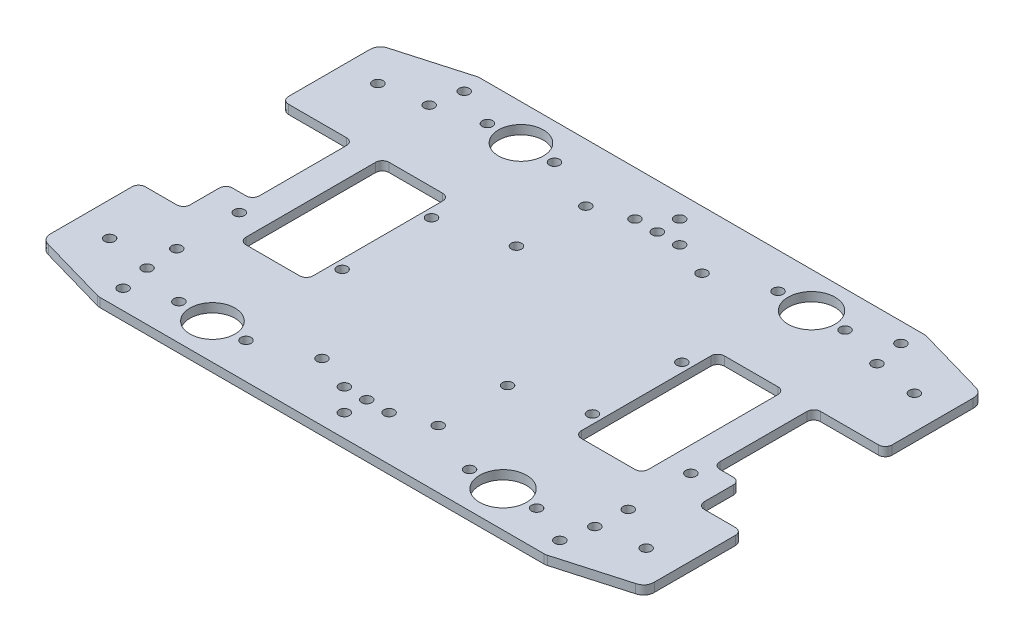
from build123d import *

# Parameters (mm, degrees)
BOSS_EXTRU_1_DEPTH                  = 4
ENL_V_MAT_EXTRU_1_REACH             = 161.581
ESQUISSE3_W                         = 20
ESQUISSE3_H                         = 64
CONG_1_R                            = 3
ENL_V_MAT_EXTRU_2_REACH             = 161.581
CONG_2_R                            = 3
ENL_V_MAT_EXTRU_3_REACH             = 161.581
ESQUISSE10_R                        = 10.075
ESQUISSE10_R_2                      = 10.5
ESQUISSE10_R_3                      = 2.3
ENL_V_MAT_EXTRU_4_REACH             = 161.581
ESQUISSE11_R                        = 2.3
ENL_V_MAT_EXTRU_5_REACH             = 161.581
ESQUISSE14_R                        = 2.3
ENL_V_MAT_EXTRU_6_REACH             = 161.581
ESQUISSE15_R                        = 2.3
ENL_V_MAT_EXTRU_9_REACH             = 161.581
ESQUISSE19_R                        = 2.3
ENL_V_MAT_EXTRU_9_DIRECTION_2_DEPTH = 160.580700728
ENL_V_MAT_EXTRU_10_REACH            = 161.581
ESQUISSE20_R                        = 2.3
ENL_V_MAT_EXTRU_11_REACH            = 161.581
ESQUISSE21_R                        = 2.3
ESQUISSE22_W                        = 15
ESQUISSE22_H                        = 45
ENL_V_MAT_EXTRU_12_DEPTH            = 6
CONG_5_R                            = 3
ESQUISSE23_R                        = 2.3
ENL_V_MAT_EXTRU_14_DEPTH            = 160.580700728


with BuildPart() as part:
    # Esquisse1 → Boss.-Extru.1 (new body)
    with BuildSketch(Plane(origin=(0, 0, 0), x_dir=(1, 0, 0), z_dir=(0, 1, 0))):
        Polygon((-135, 0), (-135, -75), (-100, -85), (0, -85), (100, -85), (135, -75), (135, 0), (135, 75), (100, 85), (0, 85), (-100, 85), (-135, 75), align=None)
    extrude(amount=BOSS_EXTRU_1_DEPTH)

    # Esquisse3 → Enlèv. mat.-Extru.1 (cut, up to next)
    with BuildSketch(Plane(origin=(0, 4, 0), x_dir=(1, 0, 0), z_dir=(0, 1, 0)), mode=Mode.PRIVATE) as enl_v_mat_extru_1_sk1:
        with Locations((-125, 0)):
            Rectangle(ESQUISSE3_W, ESQUISSE3_H)
    enl_v_mat_extru_1_tool1 = extrude(enl_v_mat_extru_1_sk1.sketch, amount=-ENL_V_MAT_EXTRU_1_REACH, mode=Mode.PRIVATE) & part.part
    enl_v_mat_extru_1 = enl_v_mat_extru_1_tool1.solids().sort_by_distance((-125, 4, 0))[0]
    add(enl_v_mat_extru_1, mode=Mode.SUBTRACT)

    # Symétrie1: Enlèv. mat.-Extru.1 across plane
    add(enl_v_mat_extru_1.mirror(Plane(origin=(0, 0, 0), x_dir=(0, 0, 1), z_dir=(1, 0, 0))), mode=Mode.SUBTRACT)

    # Congé1
    cong_1_edges = [part.edges().sort_by_distance(p)[0] for p in [
        (-115, 2, -32),
        (-115, 2, 32),
        (-135, 2, 32),
        (-135, 2, -32),
        (115, 2, 32),
        (115, 2, -32),
        (135, 2, -32),
        (135, 2, 32),
    ]]
    fillet(cong_1_edges, radius=CONG_1_R)

    # Esquisse8 → Enlèv. mat.-Extru.2 (cut, up to next)
    with BuildSketch(Plane(origin=(0, 4, 0), x_dir=(1, 0, 0), z_dir=(0, 1, 0)), mode=Mode.PRIVATE) as enl_v_mat_extru_2_sk1:
        Polygon((-90, 0), (-90, 32), (-60, 32), (-60, -32), (-90, -32), align=None)
    enl_v_mat_extru_2_tool1 = extrude(enl_v_mat_extru_2_sk1.sketch, amount=-ENL_V_MAT_EXTRU_2_REACH, mode=Mode.PRIVATE) & part.part
    enl_v_mat_extru_2 = enl_v_mat_extru_2_tool1.solids().sort_by_distance((-75, 4, 0))[0]
    add(enl_v_mat_extru_2, mode=Mode.SUBTRACT)

    # Symétrie2: Enlèv. mat.-Extru.2 across plane
    add(enl_v_mat_extru_2.mirror(Plane(origin=(0, 0, 0), x_dir=(0, 0, 1), z_dir=(1, 0, 0))), mode=Mode.SUBTRACT)

    # Congé2
    cong_2_edges = [part.edges().sort_by_distance(p)[0] for p in [
        (-90, 2, 32),
        (-90, 2, -32),
        (-60, 2, -32),
        (-60, 2, 32),
        (90, 2, 32),
        (60, 2, 32),
        (60, 2, -32),
        (90, 2, -32),
    ]]
    fillet(cong_2_edges, radius=CONG_2_R)

    # Esquisse10 → Enlèv. mat.-Extru.3 (cut, up to next)
    with BuildSketch(Plane(origin=(0, 4, 0), x_dir=(1, 0, 0), z_dir=(0, 1, 0)), mode=Mode.PRIVATE) as enl_v_mat_extru_3_sk1:
        with Locations(Location((-65, -69, 0), (0, 0, 270))):
            Circle(ESQUISSE10_R)
    enl_v_mat_extru_3_tool1 = extrude(enl_v_mat_extru_3_sk1.sketch, amount=-ENL_V_MAT_EXTRU_3_REACH, mode=Mode.PRIVATE) & part.part
    # Esquisse10 → Enlèv. mat.-Extru.3 (cut, up to next)
    with BuildSketch(Plane(origin=(0, 4, 0), x_dir=(1, 0, 0), z_dir=(0, 1, 0)), mode=Mode.PRIVATE) as enl_v_mat_extru_3_sk2:
        with Locations(Location((65, -69, 0), (0, 0, 270))):
            Circle(ESQUISSE10_R_2)
    enl_v_mat_extru_3_tool2 = extrude(enl_v_mat_extru_3_sk2.sketch, amount=-ENL_V_MAT_EXTRU_3_REACH, mode=Mode.PRIVATE) & part.part
    # Esquisse10 → Enlèv. mat.-Extru.3 (cut, up to next)
    with BuildSketch(Plane(origin=(0, 4, 0), x_dir=(1, 0, 0), z_dir=(0, 1, 0)), mode=Mode.PRIVATE) as enl_v_mat_extru_3_sk3:
        with Locations(Location((80, -69, 0), (0, 0, 270))):
            Circle(ESQUISSE10_R_3)
    enl_v_mat_extru_3_tool3 = extrude(enl_v_mat_extru_3_sk3.sketch, amount=-ENL_V_MAT_EXTRU_3_REACH, mode=Mode.PRIVATE) & part.part
    # Esquisse10 → Enlèv. mat.-Extru.3 (cut, up to next)
    with BuildSketch(Plane(origin=(0, 4, 0), x_dir=(1, 0, 0), z_dir=(0, 1, 0)), mode=Mode.PRIVATE) as enl_v_mat_extru_3_sk4:
        with Locations(Location((50, -69, 0), (0, 0, 270))):
            Circle(ESQUISSE10_R_3)
    enl_v_mat_extru_3_tool4 = extrude(enl_v_mat_extru_3_sk4.sketch, amount=-ENL_V_MAT_EXTRU_3_REACH, mode=Mode.PRIVATE) & part.part
    # Esquisse10 → Enlèv. mat.-Extru.3 (cut, up to next)
    with BuildSketch(Plane(origin=(0, 4, 0), x_dir=(1, 0, 0), z_dir=(0, 1, 0)), mode=Mode.PRIVATE) as enl_v_mat_extru_3_sk5:
        with Locations(Location((-50, -69, 0), (0, 0, 270))):
            Circle(ESQUISSE10_R_3)
    enl_v_mat_extru_3_tool5 = extrude(enl_v_mat_extru_3_sk5.sketch, amount=-ENL_V_MAT_EXTRU_3_REACH, mode=Mode.PRIVATE) & part.part
    # Esquisse10 → Enlèv. mat.-Extru.3 (cut, up to next)
    with BuildSketch(Plane(origin=(0, 4, 0), x_dir=(1, 0, 0), z_dir=(0, 1, 0)), mode=Mode.PRIVATE) as enl_v_mat_extru_3_sk6:
        with Locations(Location((-80, -69, 0), (0, 0, 270))):
            Circle(ESQUISSE10_R_3)
    enl_v_mat_extru_3_tool6 = extrude(enl_v_mat_extru_3_sk6.sketch, amount=-ENL_V_MAT_EXTRU_3_REACH, mode=Mode.PRIVATE) & part.part
    enl_v_mat_extru_3_1 = enl_v_mat_extru_3_tool1.solids().sort_by_distance((-65, 4, 69))[0]
    add(enl_v_mat_extru_3_1, mode=Mode.SUBTRACT)
    enl_v_mat_extru_3_2 = enl_v_mat_extru_3_tool2.solids().sort_by_distance((65, 4, 69))[0]
    add(enl_v_mat_extru_3_2, mode=Mode.SUBTRACT)
    enl_v_mat_extru_3_3 = enl_v_mat_extru_3_tool3.solids().sort_by_distance((80, 4, 69))[0]
    add(enl_v_mat_extru_3_3, mode=Mode.SUBTRACT)
    enl_v_mat_extru_3_4 = enl_v_mat_extru_3_tool4.solids().sort_by_distance((50, 4, 69))[0]
    add(enl_v_mat_extru_3_4, mode=Mode.SUBTRACT)
    enl_v_mat_extru_3_5 = enl_v_mat_extru_3_tool5.solids().sort_by_distance((-50, 4, 69))[0]
    add(enl_v_mat_extru_3_5, mode=Mode.SUBTRACT)
    enl_v_mat_extru_3_6 = enl_v_mat_extru_3_tool6.solids().sort_by_distance((-80, 4, 69))[0]
    add(enl_v_mat_extru_3_6, mode=Mode.SUBTRACT)
    enl_v_mat_extru_3 = enl_v_mat_extru_3_1 + enl_v_mat_extru_3_2 + enl_v_mat_extru_3_3 + enl_v_mat_extru_3_4 + enl_v_mat_extru_3_5 + enl_v_mat_extru_3_6  # Enlèv. mat.-Extru.3 as one shape, for the pattern or mirror that repeats it

    # Symétrie3: Enlèv. mat.-Extru.3 across plane
    add(enl_v_mat_extru_3.mirror(Plane.XY), mode=Mode.SUBTRACT)

    # Esquisse11 → Enlèv. mat.-Extru.4 (cut, up to next)
    with BuildSketch(Plane(origin=(0, 4, 0), x_dir=(1, 0, 0), z_dir=(0, 1, 0)), mode=Mode.PRIVATE) as enl_v_mat_extru_4_sk1:
        with Locations(Location((-56, 20, 0), (0, 0, 270))):
            Circle(ESQUISSE11_R)
    enl_v_mat_extru_4_tool1 = extrude(enl_v_mat_extru_4_sk1.sketch, amount=-ENL_V_MAT_EXTRU_4_REACH, mode=Mode.PRIVATE) & part.part
    # Esquisse11 → Enlèv. mat.-Extru.4 (cut, up to next)
    with BuildSketch(Plane(origin=(0, 4, 0), x_dir=(1, 0, 0), z_dir=(0, 1, 0)), mode=Mode.PRIVATE) as enl_v_mat_extru_4_sk2:
        with Locations(Location((-56, -20, 0), (0, 0, 270))):
            Circle(ESQUISSE11_R)
    enl_v_mat_extru_4_tool2 = extrude(enl_v_mat_extru_4_sk2.sketch, amount=-ENL_V_MAT_EXTRU_4_REACH, mode=Mode.PRIVATE) & part.part
    enl_v_mat_extru_4_1 = enl_v_mat_extru_4_tool1.solids().sort_by_distance((-56, 4, -20))[0]
    add(enl_v_mat_extru_4_1, mode=Mode.SUBTRACT)
    enl_v_mat_extru_4_2 = enl_v_mat_extru_4_tool2.solids().sort_by_distance((-56, 4, 20))[0]
    add(enl_v_mat_extru_4_2, mode=Mode.SUBTRACT)
    enl_v_mat_extru_4 = enl_v_mat_extru_4_1 + enl_v_mat_extru_4_2  # Enlèv. mat.-Extru.4 as one shape, for the pattern or mirror that repeats it

    # Symétrie4: Enlèv. mat.-Extru.4 across plane
    add(enl_v_mat_extru_4.mirror(Plane(origin=(0, 0, 0), x_dir=(0, 0, 1), z_dir=(1, 0, 0))), mode=Mode.SUBTRACT)

    # Esquisse14 → Enlèv. mat.-Extru.5 (cut, up to next)
    with BuildSketch(Plane(origin=(0, 4, 0), x_dir=(1, 0, 0), z_dir=(0, 1, 0)), mode=Mode.PRIVATE) as enl_v_mat_extru_5_sk1:
        with Locations(Location((-26, 59, 0), (0, 0, 270))):
            Circle(ESQUISSE14_R)
    enl_v_mat_extru_5_tool1 = extrude(enl_v_mat_extru_5_sk1.sketch, amount=-ENL_V_MAT_EXTRU_5_REACH, mode=Mode.PRIVATE) & part.part
    # Esquisse14 → Enlèv. mat.-Extru.5 (cut, up to next)
    with BuildSketch(Plane(origin=(0, 4, 0), x_dir=(1, 0, 0), z_dir=(0, 1, 0)), mode=Mode.PRIVATE) as enl_v_mat_extru_5_sk2:
        with Locations(Location((-26, 28, 0), (0, 0, 270))):
            Circle(ESQUISSE14_R)
    enl_v_mat_extru_5_tool2 = extrude(enl_v_mat_extru_5_sk2.sketch, amount=-ENL_V_MAT_EXTRU_5_REACH, mode=Mode.PRIVATE) & part.part
    # Esquisse14 → Enlèv. mat.-Extru.5 (cut, up to next)
    with BuildSketch(Plane(origin=(0, 4, 0), x_dir=(1, 0, 0), z_dir=(0, 1, 0)), mode=Mode.PRIVATE) as enl_v_mat_extru_5_sk3:
        with Locations(Location((-26, -59, 0), (0, 0, 270))):
            Circle(ESQUISSE14_R)
    enl_v_mat_extru_5_tool3 = extrude(enl_v_mat_extru_5_sk3.sketch, amount=-ENL_V_MAT_EXTRU_5_REACH, mode=Mode.PRIVATE) & part.part
    # Esquisse14 → Enlèv. mat.-Extru.5 (cut, up to next)
    with BuildSketch(Plane(origin=(0, 4, 0), x_dir=(1, 0, 0), z_dir=(0, 1, 0)), mode=Mode.PRIVATE) as enl_v_mat_extru_5_sk4:
        with Locations(Location((26, 59, 0), (0, 0, 270))):
            Circle(ESQUISSE14_R)
    enl_v_mat_extru_5_tool4 = extrude(enl_v_mat_extru_5_sk4.sketch, amount=-ENL_V_MAT_EXTRU_5_REACH, mode=Mode.PRIVATE) & part.part
    # Esquisse14 → Enlèv. mat.-Extru.5 (cut, up to next)
    with BuildSketch(Plane(origin=(0, 4, 0), x_dir=(1, 0, 0), z_dir=(0, 1, 0)), mode=Mode.PRIVATE) as enl_v_mat_extru_5_sk5:
        with Locations(Location((26, -28, 0), (0, 0, 270))):
            Circle(ESQUISSE14_R)
    enl_v_mat_extru_5_tool5 = extrude(enl_v_mat_extru_5_sk5.sketch, amount=-ENL_V_MAT_EXTRU_5_REACH, mode=Mode.PRIVATE) & part.part
    # Esquisse14 → Enlèv. mat.-Extru.5 (cut, up to next)
    with BuildSketch(Plane(origin=(0, 4, 0), x_dir=(1, 0, 0), z_dir=(0, 1, 0)), mode=Mode.PRIVATE) as enl_v_mat_extru_5_sk6:
        with Locations(Location((26, -59, 0), (0, 0, 270))):
            Circle(ESQUISSE14_R)
    enl_v_mat_extru_5_tool6 = extrude(enl_v_mat_extru_5_sk6.sketch, amount=-ENL_V_MAT_EXTRU_5_REACH, mode=Mode.PRIVATE) & part.part
    add(enl_v_mat_extru_5_tool1.solids().sort_by_distance((-26, 4, -59))[0], mode=Mode.SUBTRACT)
    add(enl_v_mat_extru_5_tool2.solids().sort_by_distance((-26, 4, -28))[0], mode=Mode.SUBTRACT)
    add(enl_v_mat_extru_5_tool3.solids().sort_by_distance((-26, 4, 59))[0], mode=Mode.SUBTRACT)
    add(enl_v_mat_extru_5_tool4.solids().sort_by_distance((26, 4, -59))[0], mode=Mode.SUBTRACT)
    add(enl_v_mat_extru_5_tool5.solids().sort_by_distance((26, 4, 28))[0], mode=Mode.SUBTRACT)
    add(enl_v_mat_extru_5_tool6.solids().sort_by_distance((26, 4, 59))[0], mode=Mode.SUBTRACT)

    # Esquisse15 → Enlèv. mat.-Extru.6 (cut, up to next)
    with BuildSketch(Plane(origin=(0, 4, 0), x_dir=(1, 0, 0), z_dir=(0, 1, 0)), mode=Mode.PRIVATE) as enl_v_mat_extru_6_sk1:
        with Locations(Location((-120, -60, 0), (0, 0, 270))):
            Circle(ESQUISSE15_R)
    enl_v_mat_extru_6_tool1 = extrude(enl_v_mat_extru_6_sk1.sketch, amount=-ENL_V_MAT_EXTRU_6_REACH, mode=Mode.PRIVATE) & part.part
    # Esquisse15 → Enlèv. mat.-Extru.6 (cut, up to next)
    with BuildSketch(Plane(origin=(0, 4, 0), x_dir=(1, 0, 0), z_dir=(0, 1, 0)), mode=Mode.PRIVATE) as enl_v_mat_extru_6_sk2:
        with Locations(Location((-120, 60, 0), (0, 0, 270))):
            Circle(ESQUISSE15_R)
    enl_v_mat_extru_6_tool2 = extrude(enl_v_mat_extru_6_sk2.sketch, amount=-ENL_V_MAT_EXTRU_6_REACH, mode=Mode.PRIVATE) & part.part
    enl_v_mat_extru_6_1 = enl_v_mat_extru_6_tool1.solids().sort_by_distance((-120, 4, 60))[0]
    add(enl_v_mat_extru_6_1, mode=Mode.SUBTRACT)
    enl_v_mat_extru_6_2 = enl_v_mat_extru_6_tool2.solids().sort_by_distance((-120, 4, -60))[0]
    add(enl_v_mat_extru_6_2, mode=Mode.SUBTRACT)
    enl_v_mat_extru_6 = enl_v_mat_extru_6_1 + enl_v_mat_extru_6_2  # Enlèv. mat.-Extru.6 as one shape, for the pattern or mirror that repeats it

    # Symétrie5: Enlèv. mat.-Extru.6 across plane
    add(enl_v_mat_extru_6.mirror(Plane(origin=(0, 0, 0), x_dir=(0, 0, 1), z_dir=(1, 0, 0))), mode=Mode.SUBTRACT)

    # Congé3
    # a fillet whose section is not a circle: 5 mm, written as the material it takes off along each edge
    with BuildSketch(Plane(origin=(-135, -9.428767659, -75), x_dir=(0, 0, 1), z_dir=(0, 1, 0)), Plane(origin=(135, -9.428767659, -75), x_dir=(-0.961523947640823, 0, -0.27472112789737857), z_dir=(0, 1, 0))) as cong_3_piece_1:
        with BuildLine():
            Bezier((3.771507064, 0), (0, 0), (-1.036112674, 3.626394361), weights=[1, 1, 1])
            Line((-1.036112674, 3.626394361), (0, 0))
            Line((0, 0), (3.771507064, 0))
        make_face()
    extrude(amount=22.857535319, mode=Mode.SUBTRACT)
    with BuildSketch(Plane(origin=(-100, -1.750686808, -85), x_dir=(-0.9615239476408264, 0, 0.27472112789736736), z_dir=(0, 1, 0)), Plane(origin=(100, -1.750686808, -85), x_dir=(-1, 0, 0), z_dir=(0, 1, 0))) as cong_3_piece_2:
        with BuildLine():
            Bezier((0.700274723, 0), (0, 0), (-0.673330916, 0.192380262), weights=[1, 1, 1])
            Line((-0.673330916, 0.192380262), (0, 0))
            Line((0, 0), (0.700274723, 0))
        make_face()
    extrude(amount=7.501373616, mode=Mode.SUBTRACT)
    with BuildSketch(Plane(origin=(135, -9.428767659, 75), x_dir=(-0.961523947640823, 0, 0.27472112789737857), z_dir=(0, 1, 0)), Plane(origin=(-135, -9.428767659, 75), x_dir=(0, 0, -1), z_dir=(0, 1, 0))) as cong_3_piece_3:
        with BuildLine():
            Bezier((3.771507064, 0), (0, 0), (-1.036112674, -3.626394361), weights=[1, 1, 1])
            Line((-1.036112674, -3.626394361), (0, 0))
            Line((0, 0), (3.771507064, 0))
        make_face()
    extrude(amount=22.857535319, mode=Mode.SUBTRACT)
    with BuildSketch(Plane(origin=(100, -1.750686808, 85), x_dir=(-1, 0, 0), z_dir=(0, 1, 0)), Plane(origin=(-100, -1.750686808, 85), x_dir=(-0.9615239476408246, 0, -0.2747211278973727), z_dir=(0, 1, 0))) as cong_3_piece_4:
        with BuildLine():
            Bezier((0.700274723, 0), (0, 0), (-0.673330916, -0.192380262), weights=[1, 1, 1])
            Line((-0.673330916, -0.192380262), (0, 0))
            Line((0, 0), (0.700274723, 0))
        make_face()
    extrude(amount=7.501373616, mode=Mode.SUBTRACT)

    # Esquisse19 → Enlèv. mat.-Extru.9 (cut, up to next)
    with BuildSketch(Plane(origin=(0, 4, 0), x_dir=(1, 0, 0), z_dir=(0, 1, 0)), mode=Mode.PRIVATE) as enl_v_mat_extru_9_sk1:
        with Locations(Location((-101, -49, 0), (0, 0, 270))):
            Circle(ESQUISSE19_R)
    enl_v_mat_extru_9_tool1 = extrude(enl_v_mat_extru_9_sk1.sketch, amount=-ENL_V_MAT_EXTRU_9_REACH, mode=Mode.PRIVATE) & part.part
    # Esquisse19 → Enlèv. mat.-Extru.9 (cut, up to next)
    with BuildSketch(Plane(origin=(0, 4, 0), x_dir=(1, 0, 0), z_dir=(0, 1, 0)), mode=Mode.PRIVATE) as enl_v_mat_extru_9_sk2:
        with Locations(Location((-101, -21, 0), (0, 0, 270))):
            Circle(ESQUISSE19_R)
    enl_v_mat_extru_9_tool2 = extrude(enl_v_mat_extru_9_sk2.sketch, amount=-ENL_V_MAT_EXTRU_9_REACH, mode=Mode.PRIVATE) & part.part
    enl_v_mat_extru_9_1 = enl_v_mat_extru_9_tool1.solids().sort_by_distance((-101, 4, 49))[0]
    add(enl_v_mat_extru_9_1, mode=Mode.SUBTRACT)
    enl_v_mat_extru_9_2 = enl_v_mat_extru_9_tool2.solids().sort_by_distance((-101, 4, 21))[0]
    add(enl_v_mat_extru_9_2, mode=Mode.SUBTRACT)
    enl_v_mat_extru_9 = enl_v_mat_extru_9_1 + enl_v_mat_extru_9_2  # Enlèv. mat.-Extru.9 as one shape, for the pattern or mirror that repeats it

    # Esquisse19 → Enlèv. mat.-Extru.9 direction 2 (cut)
    with BuildSketch(Plane(origin=(0, 4, 0), x_dir=(1, 0, 0), z_dir=(0, 1, 0))):
        with Locations(Location((-101, -49, 0), (0, 0, 270))):
            Circle(ESQUISSE19_R)
        with Locations(Location((-101, -21, 0), (0, 0, 270))):
            Circle(ESQUISSE19_R)
    enl_v_mat_extru_9_direction_2 = extrude(amount=ENL_V_MAT_EXTRU_9_DIRECTION_2_DEPTH, mode=Mode.SUBTRACT)

    # Symétrie7: Enlèv. mat.-Extru.9, Enlèv. mat.-Extru.9 direction 2 across plane
    add(enl_v_mat_extru_9.mirror(Plane(origin=(0, 0, 0), x_dir=(0, 0, 1), z_dir=(1, 0, 0))), mode=Mode.SUBTRACT)
    add(enl_v_mat_extru_9_direction_2.mirror(Plane(origin=(0, 0, 0), x_dir=(0, 0, 1), z_dir=(1, 0, 0))), mode=Mode.SUBTRACT)

    # Esquisse20 → Enlèv. mat.-Extru.10 (cut, up to next)
    with BuildSketch(Plane(origin=(0, 4, 0), x_dir=(1, 0, 0), z_dir=(0, 1, 0)), mode=Mode.PRIVATE) as enl_v_mat_extru_10_sk1:
        with Locations(Location((-100.158323142, -63.114435149, 0), (0, 0, 270))):
            Circle(ESQUISSE20_R)
    enl_v_mat_extru_10_tool1 = extrude(enl_v_mat_extru_10_sk1.sketch, amount=-ENL_V_MAT_EXTRU_10_REACH, mode=Mode.PRIVATE) & part.part
    # Esquisse20 → Enlèv. mat.-Extru.10 (cut, up to next)
    with BuildSketch(Plane(origin=(0, 4, 0), x_dir=(1, 0, 0), z_dir=(0, 1, 0)), mode=Mode.PRIVATE) as enl_v_mat_extru_10_sk2:
        with Locations(Location((-97.685832991, -76.301049288, 0), (0, 0, 270))):
            Circle(ESQUISSE20_R)
    enl_v_mat_extru_10_tool2 = extrude(enl_v_mat_extru_10_sk2.sketch, amount=-ENL_V_MAT_EXTRU_10_REACH, mode=Mode.PRIVATE) & part.part
    # Esquisse20 → Enlèv. mat.-Extru.10 (cut, up to next)
    with BuildSketch(Plane(origin=(0, 4, 0), x_dir=(1, 0, 0), z_dir=(0, 1, 0)), mode=Mode.PRIVATE) as enl_v_mat_extru_10_sk3:
        with Locations(Location((97.685832991, -76.301049288, 0), (0, 0, 270))):
            Circle(ESQUISSE20_R)
    enl_v_mat_extru_10_tool3 = extrude(enl_v_mat_extru_10_sk3.sketch, amount=-ENL_V_MAT_EXTRU_10_REACH, mode=Mode.PRIVATE) & part.part
    # Esquisse20 → Enlèv. mat.-Extru.10 (cut, up to next)
    with BuildSketch(Plane(origin=(0, 4, 0), x_dir=(1, 0, 0), z_dir=(0, 1, 0)), mode=Mode.PRIVATE) as enl_v_mat_extru_10_sk4:
        with Locations(Location((100.158323142, -63.114435149, 0), (0, 0, 270))):
            Circle(ESQUISSE20_R)
    enl_v_mat_extru_10_tool4 = extrude(enl_v_mat_extru_10_sk4.sketch, amount=-ENL_V_MAT_EXTRU_10_REACH, mode=Mode.PRIVATE) & part.part
    # Esquisse20 → Enlèv. mat.-Extru.10 (cut, up to next)
    with BuildSketch(Plane(origin=(0, 4, 0), x_dir=(1, 0, 0), z_dir=(0, 1, 0)), mode=Mode.PRIVATE) as enl_v_mat_extru_10_sk5:
        with Locations(Location((100.158323142, 63.114435149, 0), (0, 0, 270))):
            Circle(ESQUISSE20_R)
    enl_v_mat_extru_10_tool5 = extrude(enl_v_mat_extru_10_sk5.sketch, amount=-ENL_V_MAT_EXTRU_10_REACH, mode=Mode.PRIVATE) & part.part
    # Esquisse20 → Enlèv. mat.-Extru.10 (cut, up to next)
    with BuildSketch(Plane(origin=(0, 4, 0), x_dir=(1, 0, 0), z_dir=(0, 1, 0)), mode=Mode.PRIVATE) as enl_v_mat_extru_10_sk6:
        with Locations(Location((97.685832991, 76.301049288, 0), (0, 0, 270))):
            Circle(ESQUISSE20_R)
    enl_v_mat_extru_10_tool6 = extrude(enl_v_mat_extru_10_sk6.sketch, amount=-ENL_V_MAT_EXTRU_10_REACH, mode=Mode.PRIVATE) & part.part
    # Esquisse20 → Enlèv. mat.-Extru.10 (cut, up to next)
    with BuildSketch(Plane(origin=(0, 4, 0), x_dir=(1, 0, 0), z_dir=(0, 1, 0)), mode=Mode.PRIVATE) as enl_v_mat_extru_10_sk7:
        with Locations(Location((-97.685832991, 76.301049288, 0), (0, 0, 270))):
            Circle(ESQUISSE20_R)
    enl_v_mat_extru_10_tool7 = extrude(enl_v_mat_extru_10_sk7.sketch, amount=-ENL_V_MAT_EXTRU_10_REACH, mode=Mode.PRIVATE) & part.part
    # Esquisse20 → Enlèv. mat.-Extru.10 (cut, up to next)
    with BuildSketch(Plane(origin=(0, 4, 0), x_dir=(1, 0, 0), z_dir=(0, 1, 0)), mode=Mode.PRIVATE) as enl_v_mat_extru_10_sk8:
        with Locations(Location((-100.158323142, 63.114435149, 0), (0, 0, 270))):
            Circle(ESQUISSE20_R)
    enl_v_mat_extru_10_tool8 = extrude(enl_v_mat_extru_10_sk8.sketch, amount=-ENL_V_MAT_EXTRU_10_REACH, mode=Mode.PRIVATE) & part.part
    add(enl_v_mat_extru_10_tool1.solids().sort_by_distance((-100.158323, 4, 63.114435))[0], mode=Mode.SUBTRACT)
    add(enl_v_mat_extru_10_tool2.solids().sort_by_distance((-97.685833, 4, 76.301049))[0], mode=Mode.SUBTRACT)
    add(enl_v_mat_extru_10_tool3.solids().sort_by_distance((97.685833, 4, 76.301049))[0], mode=Mode.SUBTRACT)
    add(enl_v_mat_extru_10_tool4.solids().sort_by_distance((100.158323, 4, 63.114435))[0], mode=Mode.SUBTRACT)
    add(enl_v_mat_extru_10_tool5.solids().sort_by_distance((100.158323, 4, -63.114435))[0], mode=Mode.SUBTRACT)
    add(enl_v_mat_extru_10_tool6.solids().sort_by_distance((97.685833, 4, -76.301049))[0], mode=Mode.SUBTRACT)
    add(enl_v_mat_extru_10_tool7.solids().sort_by_distance((-97.685833, 4, -76.301049))[0], mode=Mode.SUBTRACT)
    add(enl_v_mat_extru_10_tool8.solids().sort_by_distance((-100.158323, 4, -63.114435))[0], mode=Mode.SUBTRACT)

    # Esquisse21 → Enlèv. mat.-Extru.11 (cut, up to next)
    with BuildSketch(Plane(origin=(0, 4, 0), x_dir=(1, 0, 0), z_dir=(0, 1, 0)), mode=Mode.PRIVATE) as enl_v_mat_extru_11_sk1:
        with Locations(Location((-10, -65, 0), (0, 0, 270))):
            Circle(ESQUISSE21_R)
    enl_v_mat_extru_11_tool1 = extrude(enl_v_mat_extru_11_sk1.sketch, amount=-ENL_V_MAT_EXTRU_11_REACH, mode=Mode.PRIVATE) & part.part
    # Esquisse21 → Enlèv. mat.-Extru.11 (cut, up to next)
    with BuildSketch(Plane(origin=(0, 4, 0), x_dir=(1, 0, 0), z_dir=(0, 1, 0)), mode=Mode.PRIVATE) as enl_v_mat_extru_11_sk2:
        with Locations(Location((10, -65, 0), (0, 0, 270))):
            Circle(ESQUISSE21_R)
    enl_v_mat_extru_11_tool2 = extrude(enl_v_mat_extru_11_sk2.sketch, amount=-ENL_V_MAT_EXTRU_11_REACH, mode=Mode.PRIVATE) & part.part
    # Esquisse21 → Enlèv. mat.-Extru.11 (cut, up to next)
    with BuildSketch(Plane(origin=(0, 4, 0), x_dir=(1, 0, 0), z_dir=(0, 1, 0)), mode=Mode.PRIVATE) as enl_v_mat_extru_11_sk3:
        with Locations(Location((0, -75, 0), (0, 0, 270))):
            Circle(ESQUISSE21_R)
    enl_v_mat_extru_11_tool3 = extrude(enl_v_mat_extru_11_sk3.sketch, amount=-ENL_V_MAT_EXTRU_11_REACH, mode=Mode.PRIVATE) & part.part
    # Esquisse21 → Enlèv. mat.-Extru.11 (cut, up to next)
    with BuildSketch(Plane(origin=(0, 4, 0), x_dir=(1, 0, 0), z_dir=(0, 1, 0)), mode=Mode.PRIVATE) as enl_v_mat_extru_11_sk4:
        with Locations(Location((0, 75, 0), (0, 0, 270))):
            Circle(ESQUISSE21_R)
    enl_v_mat_extru_11_tool4 = extrude(enl_v_mat_extru_11_sk4.sketch, amount=-ENL_V_MAT_EXTRU_11_REACH, mode=Mode.PRIVATE) & part.part
    # Esquisse21 → Enlèv. mat.-Extru.11 (cut, up to next)
    with BuildSketch(Plane(origin=(0, 4, 0), x_dir=(1, 0, 0), z_dir=(0, 1, 0)), mode=Mode.PRIVATE) as enl_v_mat_extru_11_sk5:
        with Locations(Location((10, 65, 0), (0, 0, 270))):
            Circle(ESQUISSE21_R)
    enl_v_mat_extru_11_tool5 = extrude(enl_v_mat_extru_11_sk5.sketch, amount=-ENL_V_MAT_EXTRU_11_REACH, mode=Mode.PRIVATE) & part.part
    # Esquisse21 → Enlèv. mat.-Extru.11 (cut, up to next)
    with BuildSketch(Plane(origin=(0, 4, 0), x_dir=(1, 0, 0), z_dir=(0, 1, 0)), mode=Mode.PRIVATE) as enl_v_mat_extru_11_sk6:
        with Locations(Location((-10, 65, 0), (0, 0, 270))):
            Circle(ESQUISSE21_R)
    enl_v_mat_extru_11_tool6 = extrude(enl_v_mat_extru_11_sk6.sketch, amount=-ENL_V_MAT_EXTRU_11_REACH, mode=Mode.PRIVATE) & part.part
    add(enl_v_mat_extru_11_tool1.solids().sort_by_distance((-10, 4, 65))[0], mode=Mode.SUBTRACT)
    add(enl_v_mat_extru_11_tool2.solids().sort_by_distance((10, 4, 65))[0], mode=Mode.SUBTRACT)
    add(enl_v_mat_extru_11_tool3.solids().sort_by_distance((0, 4, 75))[0], mode=Mode.SUBTRACT)
    add(enl_v_mat_extru_11_tool4.solids().sort_by_distance((0, 4, -75))[0], mode=Mode.SUBTRACT)
    add(enl_v_mat_extru_11_tool5.solids().sort_by_distance((10, 4, -65))[0], mode=Mode.SUBTRACT)
    add(enl_v_mat_extru_11_tool6.solids().sort_by_distance((-10, 4, -65))[0], mode=Mode.SUBTRACT)

    # Esquisse22 → Enlèv. mat.-Extru.12 (cut)
    with BuildSketch(Plane(origin=(0, 4, 0), x_dir=(1, 0, 0), z_dir=(0, 1, 0))):
        with Locations((-110.5, 9.5)):
            Rectangle(ESQUISSE22_W, ESQUISSE22_H)
    enl_v_mat_extru_12 = extrude(amount=-ENL_V_MAT_EXTRU_12_DEPTH, mode=Mode.SUBTRACT)

    # Symétrie10: Enlèv. mat.-Extru.12 across plane
    add(enl_v_mat_extru_12.mirror(Plane(origin=(0, 0, 0), x_dir=(0, 0, 1), z_dir=(1, 0, 0))), mode=Mode.SUBTRACT)

    # Congé5
    cong_5_edges = [part.edges().sort_by_distance(p)[0] for p in [
        (-115, 2, 13),
        (-103, 2, -32),
        (-103, 2, 13),
        (115, 2, 13),
        (103, 2, 13),
        (103, 2, -32),
    ]]
    fillet(cong_5_edges, radius=CONG_5_R)

    # Esquisse23 → Enlèv. mat.-Extru.14 (cut, through all)
    with BuildSketch(Plane(origin=(0, 4, 0), x_dir=(1, 0, 0), z_dir=(0, 1, 0))):
        with Locations(Location((0, -65, 0), (0, 0, 270))):
            Circle(ESQUISSE23_R)
        with Locations(Location((0, 65, 0), (0, 0, 270))):
            Circle(ESQUISSE23_R)
    extrude(amount=-ENL_V_MAT_EXTRU_14_DEPTH, mode=Mode.SUBTRACT)


solid = part.part
